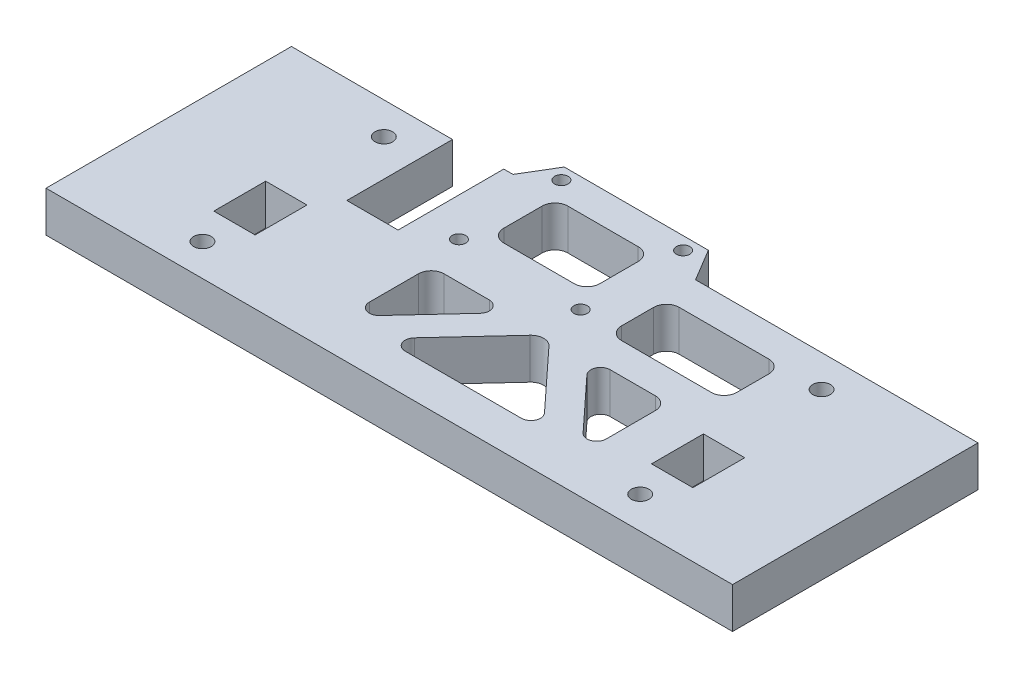
from build123d import *

# Parameters (mm, degrees)
SKETCH1_R           = 2.75
SKETCH1_W           = 12.9
SKETCH1_H           = 16.2
BOSS_EXTRUDE1_DEPTH = 12.7
SKETCH2_W           = 16
SKETCH2_H           = 41.596113018
CUT_EXTRUDE1_DEPTH  = 232.596356837
SKETCH3_R           = 2.1
CUT_EXTRUDE2_DEPTH  = 232.596356837
CUT_EXTRUDE3_DEPTH  = 232.596356837


with BuildPart() as part:
    # Sketch1 → Boss-Extrude1 (new body)
    with BuildSketch(Plane(origin=(0, 0, 0), x_dir=(1, 0, 0), z_dir=(0, 1, 0))):
        Polygon((0, 0), (214.4, 0), (214.4, 76.65), (126.2, 76.65), (120.2, 86.65), (75.2, 86.65), (69.2, 76.65), (0, 76.65), align=None)
        with Locations((38.85, 66.65)):
            Circle(SKETCH1_R, mode=Mode.SUBTRACT)
        with Locations((38.85, 10)):
            Circle(SKETCH1_R, mode=Mode.SUBTRACT)
        with Locations((175.55, 66.65)):
            Circle(SKETCH1_R, mode=Mode.SUBTRACT)
        with Locations((175.55, 10)):
            Circle(SKETCH1_R, mode=Mode.SUBTRACT)
        with Locations((38.85, 28.1)):
            Rectangle(SKETCH1_W, SKETCH1_H, mode=Mode.SUBTRACT)
        with Locations((175.55, 28.1)):
            Rectangle(SKETCH1_W, SKETCH1_H, mode=Mode.SUBTRACT)
    extrude(amount=BOSS_EXTRUDE1_DEPTH)

    # Sketch2 → Cut-Extrude1 (cut, through all)
    with BuildSketch(Plane(origin=(0, 12.7, 0), x_dir=(1, 0, 0), z_dir=(0, 1, 0))):
        with Locations((58.3, 64.448056509)):
            Rectangle(SKETCH2_W, SKETCH2_H)
    extrude(amount=-CUT_EXTRUDE1_DEPTH, mode=Mode.SUBTRACT)

    # Sketch3 → Cut-Extrude2 (cut, through all)
    with BuildSketch(Plane(origin=(0, 12.7, 0), x_dir=(1, 0, 0), z_dir=(0, 1, 0))):
        with Locations((78.3, 82.65)):
            Circle(SKETCH3_R)
        with Locations((78.3, 50.65)):
            Circle(SKETCH3_R)
        with Locations((116.3, 82.65)):
            Circle(SKETCH3_R)
        with Locations((116.3, 50.65)):
            Circle(SKETCH3_R)
    extrude(amount=-CUT_EXTRUDE2_DEPTH, mode=Mode.SUBTRACT)

    # Sketch5 → Cut-Extrude3 (cut, through all)
    with BuildSketch(Plane(origin=(0, 12.7, 0), x_dir=(1, 0, 0), z_dir=(0, 1, 0))):
        with BuildLine():
            Line((86.501282022, 17.617384584), (101.63497769, 33.961775906))
            ThreePointArc((101.63497769, 33.961775906), (102.182756625, 37.201109428), (99.433695668, 39))
            Line((99.433695668, 39), (85.3, 39))
            ThreePointArc((85.3, 39), (82.471572875, 37.828427125), (81.3, 35))
            Line((81.3, 35), (81.3, 19.655608678))
            ThreePointArc((81.3, 19.655608678), (83.205432977, 16.862416413), (86.501282022, 17.617384584))
        make_face()
        with BuildLine():
            Line((115.364957304, 35.830153888), (97.96502231, 17.038224094))
            ThreePointArc((97.96502231, 17.038224094), (97.417243375, 13.798890572), (100.166304332, 12))
            Line((100.166304332, 12), (136.433695668, 12))
            ThreePointArc((136.433695668, 12), (139.182756625, 13.798890572), (138.63497769, 17.038224094))
            Line((138.63497769, 17.038224094), (121.235042696, 35.830153888))
            ThreePointArc((121.235042696, 35.830153888), (118.3, 37.112521762), (115.364957304, 35.830153888))
        make_face()
        with BuildLine():
            Line((137.166304332, 39), (151.3, 39))
            ThreePointArc((151.3, 39), (154.128427125, 37.828427125), (155.3, 35))
            Line((155.3, 35), (155.3, 19.655608678))
            ThreePointArc((155.3, 19.655608678), (153.394567023, 16.862416413), (150.098717978, 17.617384584))
            Line((150.098717978, 17.617384584), (134.96502231, 33.961775906))
            ThreePointArc((134.96502231, 33.961775906), (134.417243375, 37.201109428), (137.166304332, 39))
        make_face()
        with BuildLine():
            Line((86.3, 76.65), (108.3, 76.65))
            ThreePointArc((108.3, 76.65), (111.128427125, 75.478427125), (112.3, 72.65))
            Line((112.3, 72.65), (112.3, 60.65))
            ThreePointArc((112.3, 60.65), (111.128427125, 57.821572875), (108.3, 56.65))
            Line((108.3, 56.65), (86.3, 56.65))
            ThreePointArc((86.3, 56.65), (83.471572875, 57.821572875), (82.3, 60.65))
            Line((82.3, 60.65), (82.3, 72.65))
            ThreePointArc((82.3, 72.65), (83.471572875, 75.478427125), (86.3, 76.65))
        make_face()
        with BuildLine():
            Line((131.1, 66.65), (159.1, 66.65))
            ThreePointArc((159.1, 66.65), (161.928427125, 65.478427125), (163.1, 62.65))
            Line((163.1, 62.65), (163.1, 52.65))
            ThreePointArc((163.1, 52.65), (161.928427125, 49.821572875), (159.1, 48.65))
            Line((159.1, 48.65), (131.1, 48.65))
            ThreePointArc((131.1, 48.65), (128.271572875, 49.821572875), (127.1, 52.65))
            Line((127.1, 52.65), (127.1, 62.65))
            ThreePointArc((127.1, 62.65), (128.271572875, 65.478427125), (131.1, 66.65))
        make_face()
    extrude(amount=-CUT_EXTRUDE3_DEPTH, mode=Mode.SUBTRACT)


solid = part.part
